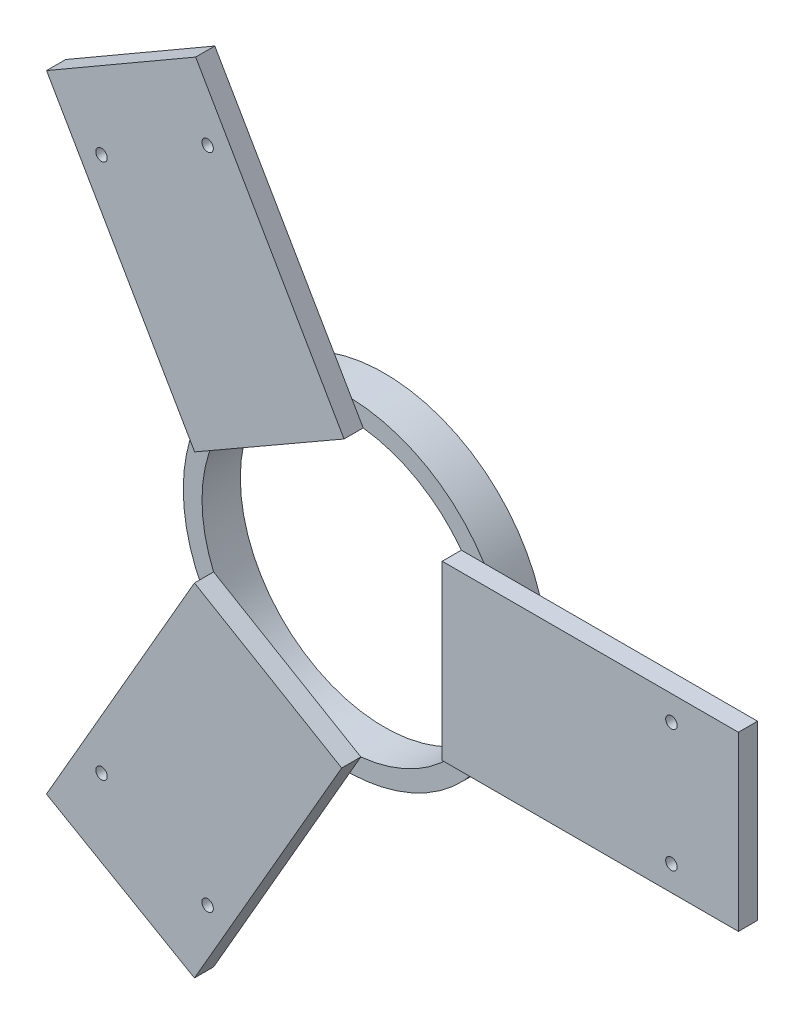
from build123d import *

# Parameters (mm, degrees)
SKETCH1_R           = 85
BOSS_EXTRUDE1_DEPTH = 20
SKETCH2_R           = 75.2
CUT_EXTRUDE1_DEPTH  = 40
BOSS_EXTRUDE2_DEPTH = 10
SKETCH4_R           = 3
CUT_EXTRUDE2_DEPTH  = 50
SKETCH5_R           = 3
CUT_EXTRUDE3_DEPTH  = 50
BOSS_EXTRUDE3_DEPTH = 10
SKETCH7_R           = 3
CUT_EXTRUDE4_DEPTH  = 50
SKETCH8_R           = 3
CUT_EXTRUDE5_DEPTH  = 50
BOSS_EXTRUDE4_DEPTH = 10
SKETCH10_R          = 3
CUT_EXTRUDE6_DEPTH  = 50
SKETCH11_R          = 3
CUT_EXTRUDE7_DEPTH  = 50


with BuildPart() as part:
    # Sketch1 → Boss-Extrude1 (new body)
    with BuildSketch(Plane.XY):
        with Locations((300, 300)):
            Circle(SKETCH1_R)
    extrude(amount=BOSS_EXTRUDE1_DEPTH)

    # Sketch2 → Cut-Extrude1 (cut)
    with BuildSketch(Plane.XY.offset(20)):
        with Locations((300, 300)):
            Circle(SKETCH2_R)
    extrude(amount=-CUT_EXTRUDE1_DEPTH, mode=Mode.SUBTRACT)

    # Sketch3 → Boss-Extrude2 (add)
    with BuildSketch(Plane.XY.offset(20)):
        Polygon((360.16, 254.88), (515, 254.88), (515, 345), (360.249813278, 345), align=None)
    extrude(amount=BOSS_EXTRUDE2_DEPTH)

    # Sketch4 → Cut-Extrude2 (cut)
    with BuildSketch(Plane.XY.offset(30)):
        with Locations((480, 268)):
            Circle(SKETCH4_R)
    extrude(amount=-CUT_EXTRUDE2_DEPTH, mode=Mode.SUBTRACT)

    # Sketch5 → Cut-Extrude3 (cut)
    with BuildSketch(Plane.XY.offset(30)):
        with Locations((480, 332)):
            Circle(SKETCH5_R)
    extrude(amount=-CUT_EXTRUDE3_DEPTH, mode=Mode.SUBTRACT)

    # Sketch6 → Boss-Extrude3 (add)
    with BuildSketch(Plane.XY.offset(20)):
        Polygon((308.995066219, 374.660088292), (231.47114317, 508.695461814), (153.563778331, 463.635084109), (230.963084162, 329.815168147), align=None)
    extrude(amount=BOSS_EXTRUDE3_DEPTH)

    # Sketch7 → Cut-Extrude4 (cut)
    with BuildSketch(Plane.XY.offset(30)):
        with Locations((237.712812921, 471.884572681)):
            Circle(SKETCH7_R)
    extrude(amount=-CUT_EXTRUDE4_DEPTH, mode=Mode.SUBTRACT)

    # Sketch8 → Cut-Extrude5 (cut)
    with BuildSketch(Plane.XY.offset(30)):
        with Locations((182.287187079, 439.884572681)):
            Circle(SKETCH8_R)
    extrude(amount=-CUT_EXTRUDE5_DEPTH, mode=Mode.SUBTRACT)

    # Sketch9 → Boss-Extrude4 (add)
    with BuildSketch(Plane.XY.offset(20)):
        Polygon((230.844933781, 270.459911708), (153.52885683, 136.304538186), (230.844933781, 91.745937228), (307.757523374, 225.201197663), align=None)
    extrude(amount=BOSS_EXTRUDE4_DEPTH)

    # Sketch10 → Cut-Extrude6 (cut)
    with BuildSketch(Plane.XY.offset(30)):
        with Locations((182.287187079, 160.115427319)):
            Circle(SKETCH10_R)
    extrude(amount=-CUT_EXTRUDE6_DEPTH, mode=Mode.SUBTRACT)

    # Sketch11 → Cut-Extrude7 (cut)
    with BuildSketch(Plane.XY.offset(30)):
        with Locations((237.712812921, 128.115427319)):
            Circle(SKETCH11_R)
    extrude(amount=-CUT_EXTRUDE7_DEPTH, mode=Mode.SUBTRACT)


solid = part.part
